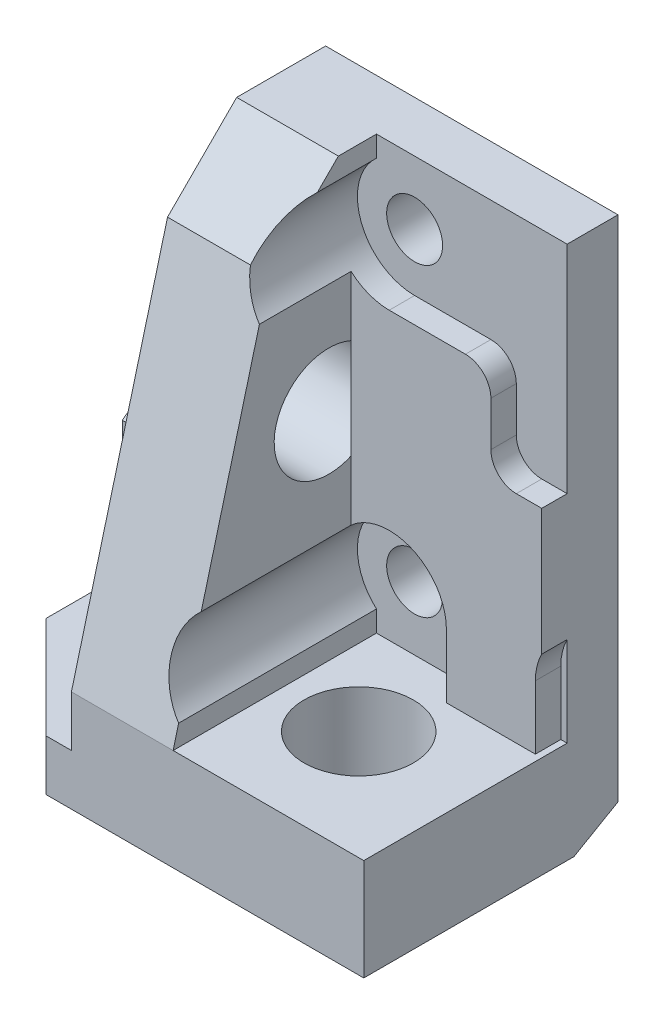
from build123d import *

# Parameters (mm, degrees)
SKETCH_1_W               = 23
SKETCH_1_H               = 17
SKETCH_1_R               = 1.1
EXTRUDE_1_DEPTH          = 3
EXTRUDE_2_DEPTH          = 6
CUT_EXTRUDE_1_DEPTH      = 23.349496639
CUT_EXTRUDE_1_DEPTH_BACK = 1
SKETCH_3_R               = 2.25
CUT_EXTRUDE_2_REACH      = 24.349
SKETCH_4_W               = 4.5
SKETCH_4_H               = 17
CUT_EXTRUDE_3_DEPTH      = 2
SKETCH_6_R               = 2.15
CUT_EXTRUDE_4_DEPTH      = 4
SKETCH_7_W               = 16.5
SKETCH_7_H               = 10
EXTRUDE_3_DEPTH          = 4
SKETCH_8_R               = 2.15
CUT_EXTRUDE_5_DEPTH      = 4
CHAMFER_1_SIZE           = 1
CHAMFER_1_SIZE2          = 1.732050808
CHAMFER_2_SIZE           = 4
CUT_EXTRUDE_6_DEPTH      = 1
FILLET_1_R               = 2
CUT_EXTRUDE_7_REACH      = 21.881
FILLET_2_R               = 1
CHAMFER_3_SIZE           = 2
CHAMFER_3_SIZE2          = 2.813680863
CUT_EXTRUDE_8_REACH      = 27.729
SKETCH_11_W              = 5
SKETCH_11_H              = 10
EXTRUDE_4_DEPTH          = 5
CUT_EXTRUDE_9_REACH      = 21.222
SKETCH_13_R              = 1.1
SKETCH_14_R              = 2.25
CUT_EXTRUDE_10_DEPTH     = 1
EXTRUDE_6_REACH          = 26.135
FILLET_3_R               = 2
SKETCH_15_W              = 5
SKETCH_15_H              = 2
EXTRUDE_5_DEPTH          = 7
CUT_EXTRUDE_11_DEPTH     = 5
CHAMFER_4_SIZE           = 4


with BuildPart() as part:
    # 草图1 → 凸台-拉伸1 (new body)
    with BuildSketch(Plane.XY):
        with Locations((4, 6)):
            Rectangle(SKETCH_1_W, SKETCH_1_H)
        Circle(SKETCH_1_R, mode=Mode.SUBTRACT)
        with Locations((8, 0)):
            Circle(SKETCH_1_R, mode=Mode.SUBTRACT)
        with Locations((0, 12)):
            Circle(SKETCH_1_R, mode=Mode.SUBTRACT)
        with Locations((8, 12)):
            Circle(SKETCH_1_R, mode=Mode.SUBTRACT)
    extrude(amount=EXTRUDE_1_DEPTH)

    # 草图2 → 凸台-拉伸2 (add)
    with BuildSketch(Plane.ZY.offset(7.5)):
        Polygon((5.5, 14.5), (10, -2.5), (5.5, -2.5), (0, -2.5), (0, 14.5), align=None)
    extrude(amount=-EXTRUDE_2_DEPTH)

    # 草图3 → 切除-拉伸1 (cut, two sides: drawn at the far end of the back side and taken through both)
    with BuildSketch(Plane.XY.offset(3).offset(-CUT_EXTRUDE_1_DEPTH_BACK)):
        with Locations(Location((0, 12, 0), (0, 0, 228.189685104))):
            Circle(SKETCH_3_R)
        with Locations((8, 12)):
            Circle(SKETCH_3_R)
        with Locations(Location((0, 0, 0), (0, 0, 131.810314896))):
            Circle(SKETCH_3_R)
        with Locations((8, 0)):
            Circle(SKETCH_3_R)
    extrude(amount=CUT_EXTRUDE_1_DEPTH + CUT_EXTRUDE_1_DEPTH_BACK, mode=Mode.SUBTRACT)

    # 草图4 → 切除-拉伸2 (cut, up to next)
    with BuildSketch(Plane.XY.offset(3), mode=Mode.PRIVATE) as cut_extrude_2_sk1:
        with Locations((13.25, 6)):
            Rectangle(SKETCH_4_W, SKETCH_4_H)
    cut_extrude_2_tool1 = extrude(cut_extrude_2_sk1.sketch, amount=-CUT_EXTRUDE_2_REACH, mode=Mode.PRIVATE) & part.part
    add(cut_extrude_2_tool1.solids().sort_by_distance((13.25, 6, 3))[0], mode=Mode.SUBTRACT)

    # 草图5 → 切除-拉伸3 (cut)
    with BuildSketch(Plane.ZY.offset(7.5)):
        Polygon((0, 14.5), (0, -2.5), (10, -2.5), (5.5, 14.5), align=None)
    extrude(amount=-CUT_EXTRUDE_3_DEPTH, mode=Mode.SUBTRACT)

    # 草图6 → 切除-拉伸4 (cut)
    with BuildSketch(Plane.ZY.offset(5.5)):
        with Locations(Location((3.875, 6, 0), (0, 0, 270))):
            Circle(SKETCH_6_R)
    extrude(amount=-CUT_EXTRUDE_4_DEPTH, mode=Mode.SUBTRACT)

    # 草图7 → 凸台-拉伸3 (add)
    with BuildSketch(Plane.XZ.offset(2.5)):
        with Locations((2.75, 5)):
            Rectangle(SKETCH_7_W, SKETCH_7_H)
    extrude(amount=EXTRUDE_3_DEPTH)

    # 草图8 → 切除-拉伸5 (cut)
    with BuildSketch(Plane.XZ.offset(6.5)):
        with Locations(Location((1.5, 5.7, 0), (0, 0, 270))):
            Circle(SKETCH_8_R)
    extrude(amount=-CUT_EXTRUDE_5_DEPTH, mode=Mode.SUBTRACT)

    # 倒角1
    chamfer_1_edges = [part.edges().sort_by_distance(p)[0] for p in [
        (2.75, -6.5, 0),
    ]]
    chamfer_1_side = [part.faces().sort_by_distance(p)[0] for p in [
        (2.692629218, 3.908206749, 0),
    ]]
    chamfer(chamfer_1_edges, length=CHAMFER_1_SIZE, length2=CHAMFER_1_SIZE2, reference=chamfer_1_side[0])

    # 倒角2
    chamfer_2_edges = [part.edges().sort_by_distance(p)[0] for p in [
        (11, -4.5, 10),
    ]]
    chamfer(chamfer_2_edges, length=CHAMFER_2_SIZE)

    # 草图9 → 切除-拉伸6 (cut)
    with BuildSketch(Plane.XY.offset(3)):
        with BuildLine():
            Line((-1.5, 13.677050983), (-1.5, 14.5))
            Line((-1.5, 14.5), (2.25, 14.5))
            Line((2.25, 14.5), (2.25, 12))
            ThreePointArc((2.25, 12), (0.918558654, 14.053959591), (-1.5, 13.677050983))
        make_face()
        with BuildLine():
            Line((5.75, 12), (5.75, 14.5))
            Line((5.75, 14.5), (11, 14.5))
            Line((11, 14.5), (11, 9.75))
            Line((11, 9.75), (8, 9.75))
            ThreePointArc((8, 9.75), (9.590990258, 13.590990258), (5.75, 12))
        make_face()
        with BuildLine():
            Line((2.25, 0), (2.25, -2.5))
            Line((2.25, -2.5), (-1.5, -2.5))
            Line((-1.5, -2.5), (-1.5, -1.677050983))
            ThreePointArc((-1.5, -1.677050983), (0.918558654, -2.053959591), (2.25, 0))
        make_face()
        with BuildLine():
            Line((5.75, 0), (5.75, -2.5))
            Line((5.75, -2.5), (11, -2.5))
            Line((11, -2.5), (11, 2.25))
            Line((11, 2.25), (8, 2.25))
            ThreePointArc((8, 2.25), (9.590990258, -1.590990258), (5.75, 0))
        make_face()
    extrude(amount=-CUT_EXTRUDE_6_DEPTH, mode=Mode.SUBTRACT)

    # 圆角1
    fillet_1_edges = [part.edges().sort_by_distance(p)[0] for p in [
        (11, 14.5, 1),
    ]]
    fillet(fillet_1_edges, radius=FILLET_1_R)

    # 草图10 → 切除-拉伸7 (cut, up to next)
    with BuildSketch(Plane.XY.offset(2), mode=Mode.PRIVATE) as cut_extrude_7_sk1:
        with BuildLine():
            Line((4, 14.5), (11, 14.5))
            Line((11, 14.5), (11, 6))
            Line((11, 6), (4, 6))
            Line((4, 6), (4, 9.75))
            Line((4, 9.75), (0, 9.75))
            ThreePointArc((0, 9.75), (1.590990258, 10.409009742), (2.25, 12))
            Line((2.25, 12), (2.25, 14.5))
            Line((2.25, 14.5), (4, 14.5))
        make_face()
    cut_extrude_7_tool1 = extrude(cut_extrude_7_sk1.sketch, amount=CUT_EXTRUDE_7_REACH, mode=Mode.PRIVATE) & part.part
    add(cut_extrude_7_tool1.solids().sort_by_distance((6.881457, 10.476255, 2))[0], mode=Mode.SUBTRACT)

    # 圆角2
    fillet_2_edges = [part.edges().sort_by_distance(p)[0] for p in [
        (4, 9.75, 2.5),
        (4, 6, 2.5),
    ]]
    fillet(fillet_2_edges, radius=FILLET_2_R)

    # 倒角3
    chamfer_3_edges = [part.edges().sort_by_distance(p)[0] for p in [
        (-3.5, 14.5, 5.5),
    ]]
    chamfer_3_side = [part.faces().sort_by_distance(p)[0] for p in [
        (0.040697674, 14.5, 1.895348837),
    ]]
    chamfer(chamfer_3_edges, length=CHAMFER_3_SIZE, length2=CHAMFER_3_SIZE2, reference=chamfer_3_side[0])

    # 草图11 → 切除-拉伸8 (cut, up to next)
    with BuildSketch(Plane.XZ.offset(6.5), mode=Mode.PRIVATE) as cut_extrude_8_sk1:
        with Locations((8.5, 5)):
            Rectangle(SKETCH_11_W, SKETCH_11_H)
    cut_extrude_8_tool1 = extrude(cut_extrude_8_sk1.sketch, amount=-CUT_EXTRUDE_8_REACH, mode=Mode.PRIVATE) & part.part
    add(cut_extrude_8_tool1.solids().sort_by_distance((8.5, -6.5, 5))[0], mode=Mode.SUBTRACT)

    # 草图12 → 凸台-拉伸4 (add)
    with BuildSketch(Plane.ZY.offset(5.5)):
        Polygon((0, -5.5), (1.732050808, -6.5), (3, -6.5), (3, 1.5), (0, 1.5), align=None)
    extrude(amount=EXTRUDE_4_DEPTH)

    # 草图13 → 切除-拉伸9 (cut, up to next)
    with BuildSketch(Plane.XY.offset(3), mode=Mode.PRIVATE) as cut_extrude_9_sk1:
        with Locations((-8, 0)):
            Circle(SKETCH_13_R)
    cut_extrude_9_tool1 = extrude(cut_extrude_9_sk1.sketch, amount=-CUT_EXTRUDE_9_REACH, mode=Mode.PRIVATE) & part.part
    add(cut_extrude_9_tool1.solids().sort_by_distance((-8, 0, 3))[0], mode=Mode.SUBTRACT)

    # 草图14 → 切除-拉伸10 (cut)
    with BuildSketch(Plane.XY.offset(3)):
        with Locations((-8, 0)):
            Circle(SKETCH_14_R)
    extrude(amount=-CUT_EXTRUDE_10_DEPTH, mode=Mode.SUBTRACT)

    # 凸台-拉伸6: up to this face of the body (flat: up to its plane)
    extrude_6_end = Plane(part.part.faces().sort_by_distance((-5.5, 3.356262463, 4.741493194))[0])
    # 草图16 → 凸台-拉伸6 (add, up to the picked face)
    with BuildSketch(Plane.ZY.offset(10.5), mode=Mode.PRIVATE) as extrude_6_sk1:
        Polygon((2, 1.5), (0, 3), (0, 1.5), align=None)
    extrude_6_tool1 = split(extrude(extrude_6_sk1.sketch, amount=-EXTRUDE_6_REACH, mode=Mode.PRIVATE), bisect_by=extrude_6_end, keep=Keep.BOTH, mode=Mode.PRIVATE)
    add(extrude_6_tool1.solids().sort_by(Axis((-10.5, 2, 0.666667), (1, 0, 0)))[0])

    # 圆角3
    # the kernel refuses this fillet: 2 mm, written as the material it takes off along each edge
    with BuildSketch(Plane(origin=(-10.5, 1.5, 7.042393307), x_dir=(1, 0, 0), z_dir=(0, 0, -1))) as fillet_3_piece_1_section:
        with BuildLine():
            CenterArc((2, 1.616957323), FILLET_3_R, 180, 53.947557716)
            Line((0, 1.616957323), (0, 0))
            Line((0, 0), (0.822949017, 0))
        make_face()
    fillet_3_piece_1 = extrude(amount=9.084786613, mode=Mode.PRIVATE)
    fillet_3_piece_1 = split(fillet_3_piece_1, bisect_by=Plane(origin=(-10.039236146, 1.139870627, 2.480172498), z_dir=(0, 0.8000000000000002, 0.6)), keep=Keep.TOP, mode=Mode.PRIVATE)
    add(fillet_3_piece_1, mode=Mode.SUBTRACT)

    # 草图15 → 凸台-拉伸5 (add)
    with BuildSketch(Plane.XY.offset(3)):
        with Locations((-8, -5.5)):
            Rectangle(SKETCH_15_W, SKETCH_15_H)
    extrude(amount=EXTRUDE_5_DEPTH)

    # 草图17 → 切除-拉伸11 (cut)
    with BuildSketch(Plane.ZY.offset(10.5)):
        Polygon((2, 1.5), (3, 0.75), (3, 1.5), align=None)
    extrude(amount=-CUT_EXTRUDE_11_DEPTH, mode=Mode.SUBTRACT)

    # 倒角4
    chamfer_4_edges = [part.edges().sort_by_distance(p)[0] for p in [
        (-10.5, -5.5, 10),
    ]]
    chamfer(chamfer_4_edges, length=CHAMFER_4_SIZE)


solid = part.part
